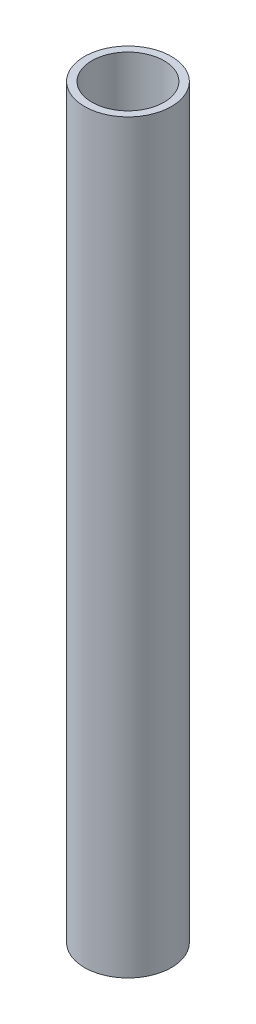
from build123d import *

# Parameters (mm, degrees)
SKETCH1_R           = 21.082
SKETCH1_R_2         = 17.5006
BOSS_EXTRUDE1_DEPTH = 361.95


with BuildPart() as part:
    # Sketch1 → Boss-Extrude1 (new body)
    with BuildSketch(Plane(origin=(0, 0, 0), x_dir=(1, 0, 0), z_dir=(0, 1, 0))):
        Circle(SKETCH1_R)
        Circle(SKETCH1_R_2, mode=Mode.SUBTRACT)
    extrude(amount=BOSS_EXTRUDE1_DEPTH)


solid = part.part
